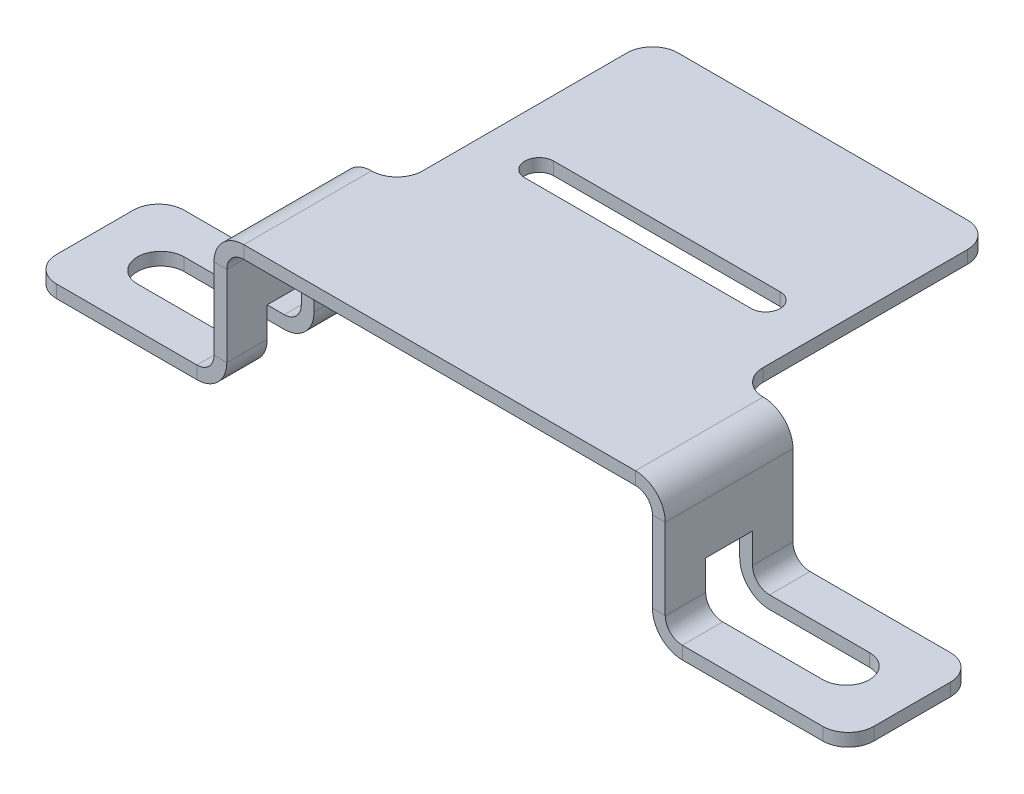
from build123d import *

# Parameters (mm, degrees)
ODGI_CIE_BAZOWE1_DEPTH      = 7.5
SZCZELINA_START             = -15
SZCZELINA_POD_RUB_M51_DEPTH = 1.5
SZKIC8_W                    = 40
SZKIC8_H                    = 30
WYPUST1_DEPTH               = 1.5
SZCZELINA_POD_RUB_M31_DEPTH = 1.5
SZKIC13_W                   = 4.75
SZKIC13_H                   = 5.5
WYTNIJ_WYCI_GNI_CIE1_DEPTH  = 7
ZAOKR_GLENIE1_R             = 3


# Read off the part's stored shape, not the designer's step: Szczelina pod śrubę M51, Szczelina pod śrubę M31
# Sheet-metal steps are written as plain solids
with BuildPart() as part:
    # Szkic1 → Odgięcie bazowe1 (new, symmetric)
    with BuildSketch(Plane.XY):
        with BuildLine():
            Line((-48, -15), (-28.5, -15))
            ThreePointArc((-28.5, -15), (-26.025126266, -13.974873734), (-25, -11.5))
            Line((-25, -11.5), (-25, -2))
            ThreePointArc((-25, -2), (-24.414213562, -0.585786438), (-23, 0))
            Line((-23, 0), (23, 0))
            ThreePointArc((23, 0), (24.414213562, -0.585786438), (25, -2))
            Line((25, -2), (25, -11.5))
            ThreePointArc((25, -11.5), (26.025126266, -13.974873734), (28.5, -15))
            Line((28.5, -15), (48, -15))
            Line((48, -15), (48, -13.5))
            Line((48, -13.5), (28.5, -13.5))
            ThreePointArc((28.5, -13.5), (27.085786438, -12.914213562), (26.5, -11.5))
            Line((26.5, -11.5), (26.5, -2))
            ThreePointArc((26.5, -2), (25.474873734, 0.474873734), (23, 1.5))
            Line((23, 1.5), (-23, 1.5))
            ThreePointArc((-23, 1.5), (-25.474873734, 0.474873734), (-26.5, -2))
            Line((-26.5, -2), (-26.5, -11.5))
            ThreePointArc((-26.5, -11.5), (-27.085786438, -12.914213562), (-28.5, -13.5))
            Line((-28.5, -13.5), (-48, -13.5))
            Line((-48, -13.5), (-48, -15))
        make_face()
    extrude(amount=ODGI_CIE_BAZOWE1_DEPTH, both=True)

    # Szczelina pod śrubę M51 outline → Szczelina pod śrubę M51 (cut)
    with BuildSketch(Plane(origin=(0, 0, 0), x_dir=(1, 0, 0), z_dir=(0, 1, 0)).offset(SZCZELINA_START)):
        with BuildLine():
            Line((29.75, -2.75), (40.25, -2.75))
            ThreePointArc((40.25, -2.75), (43, 0), (40.25, 2.75))
            Line((40.25, 2.75), (29.75, 2.75))
            ThreePointArc((29.75, 2.75), (27, 0), (29.75, -2.75))
        make_face()
        with BuildLine():
            ThreePointArc((-29.75, -2.75), (-27, 0), (-29.75, 2.75))
            Line((-29.75, 2.75), (-40.25, 2.75))
            ThreePointArc((-40.25, 2.75), (-43, 0), (-40.25, -2.75))
            Line((-40.25, -2.75), (-29.75, -2.75))
        make_face()
    extrude(amount=SZCZELINA_POD_RUB_M51_DEPTH, mode=Mode.SUBTRACT)

    # Szkic8 → Wypust1 (add)
    with BuildSketch(Plane(origin=(0, 1.5, 0), x_dir=(1, 0, 0), z_dir=(0, 1, 0))):
        with Locations((0, 22.5)):
            Rectangle(SZKIC8_W, SZKIC8_H)
    extrude(amount=-WYPUST1_DEPTH)

    # Szczelina pod śrubę M31 outline → Szczelina pod śrubę M31 (cut)
    with BuildSketch(Plane(origin=(0, 0, 0), x_dir=(1, 0, 0), z_dir=(0, 1, 0))):
        with BuildLine():
            Line((-13.3, 15.8), (13.3, 15.8))
            ThreePointArc((13.3, 15.8), (15, 17.5), (13.3, 19.2))
            Line((13.3, 19.2), (-13.3, 19.2))
            ThreePointArc((-13.3, 19.2), (-15, 17.5), (-13.3, 15.8))
        make_face()
    extrude(amount=SZCZELINA_POD_RUB_M31_DEPTH, mode=Mode.SUBTRACT)

    # Szkic13 → Wytnij-wyciągnięcie1 (cut)
    with BuildSketch(Plane.XZ.offset(15)):
        with Locations((-27.375, 0)):
            Rectangle(SZKIC13_W, SZKIC13_H)
        with Locations((27.375, 0)):
            Rectangle(SZKIC13_W, SZKIC13_H)
    extrude(amount=-WYTNIJ_WYCI_GNI_CIE1_DEPTH, mode=Mode.SUBTRACT)

    # Zaokrąglenie1
    zaokr_glenie1_edges = [part.edges().sort_by_distance(p)[0] for p in [
        (48, -14.25, 7.5),
        (48, -14.25, -7.5),
        (20, 0.75, -37.5),
        (-20, 0.75, -37.5),
        (-48, -14.25, -7.5),
        (-48, -14.25, 7.5),
        (20, 0.75, -7.5),
        (-20, 0.75, -7.5),
    ]]
    fillet(zaokr_glenie1_edges, radius=ZAOKR_GLENIE1_R)


solid = part.part
